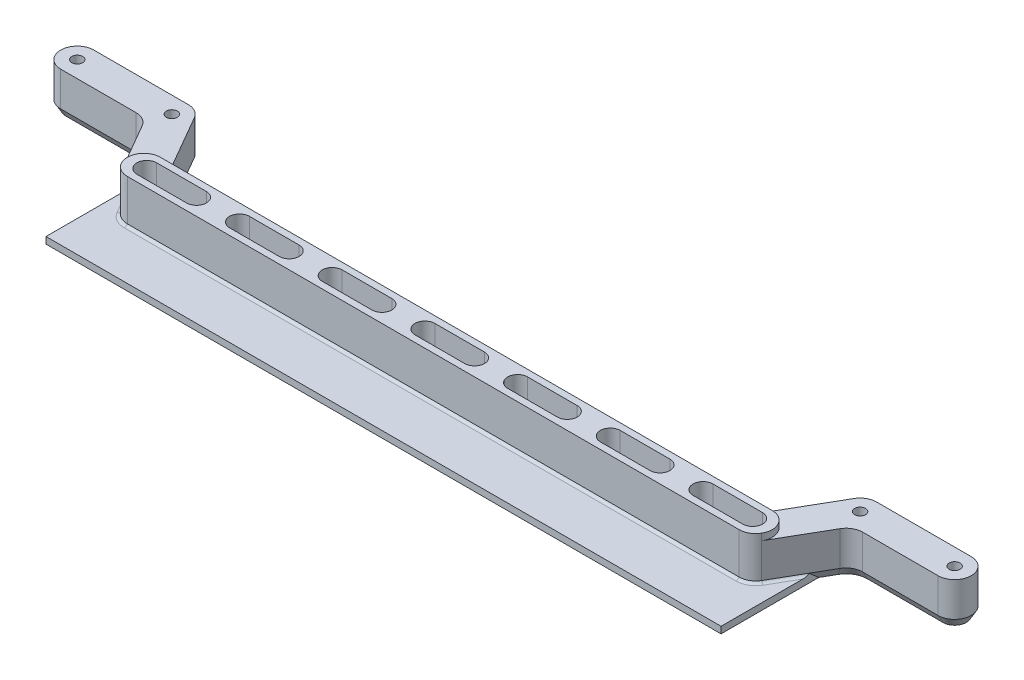
from build123d import *

# Parameters (mm, degrees)
SKETCH_1_R                 = 1.65
EXTRUDE_1_DEPTH            = 15
FILLET_1_R                 = 5
CHAMFER_1_SIZE             = 1.5
CHAMFER_1_SIZE2            = 2.598076211
SKETCH_3_R                 = 2.5
CUT_EXTRUDE_1_DEPTH        = 3
SKETCH_4_W                 = 353.760068279
SKETCH_4_H                 = 71.916373997
CUT_EXTRUDE_2_DEPTH        = 2
FILLET_2_R                 = 5
CUT_EXTRUDE_3_DEPTH        = 12
PATTERN_LINEAR_1_COUNT     = 4
PATTERN_LINEAR_1_PITCH     = 28
PATTERN_LINEAR_1_COL_COUNT = 4
PATTERN_LINEAR_1_COL_PITCH = 28
EXTRUDE_2_DEPTH            = 2
FILLET_3_R                 = 1


# Some blends are built 0.0001 mm under size
with BuildPart() as part:
    # 草图1 → 凸台-拉伸1 (new body)
    with BuildSketch(Plane(origin=(0, 0, 0), x_dir=(1, 0, 0), z_dir=(0, 1, 0))):
        with BuildLine():
            Line((14.275, 5), (-14.275, 5))
            ThreePointArc((-14.275, 5), (-19.275, 0), (-14.275, -5))
            Line((-14.275, -5), (11.388248654, -5))
            Line((11.388248654, -5), (21.491878365, -22.5))
            ThreePointArc((21.491878365, -22.5), (23.322005384, -24.330127019), (25.822005384, -25))
            Line((25.822005384, -25), (210.627994616, -25))
            ThreePointArc((210.627994616, -25), (213.127994616, -24.330127019), (214.958121635, -22.5))
            Line((214.958121635, -22.5), (225.061751346, -5))
            Line((225.061751346, -5), (250.725, -5))
            ThreePointArc((250.725, -5), (255.725, 0), (250.725, 5))
            Line((250.725, 5), (222.175, 5))
            ThreePointArc((222.175, 5), (219.675, 4.330127019), (217.844872981, 2.5))
            Line((217.844872981, 2.5), (207.74124327, -15))
            Line((207.74124327, -15), (28.70875673, -15))
            Line((28.70875673, -15), (18.605127019, 2.5))
            ThreePointArc((18.605127019, 2.5), (16.775, 4.330127019), (14.275, 5))
        make_face()
        with Locations(Location((-14.275, 0, 0), (0, 0, 270))):
            Circle(SKETCH_1_R, mode=Mode.SUBTRACT)
        with Locations(Location((14.275, 0, 0), (0, 0, 270))):
            Circle(SKETCH_1_R, mode=Mode.SUBTRACT)
        with Locations(Location((222.175, 0, 0), (0, 0, 270))):
            Circle(SKETCH_1_R, mode=Mode.SUBTRACT)
        with Locations(Location((250.725, 0, 0), (0, 0, 270))):
            Circle(SKETCH_1_R, mode=Mode.SUBTRACT)
    extrude(amount=EXTRUDE_1_DEPTH)

    # 圆角1
    fillet_1_edges = [part.edges().sort_by_distance(p)[0] for p in [
        (225.061751346, 7.5, 5),
        (11.388248654, 7.5, 5),
        (28.70875673, 7.5, 15),
        (207.74124327, 7.5, 15),
    ]]
    fillet(fillet_1_edges, radius=FILLET_1_R)

    # 倒角1
    chamfer_1_edges = [part.edges().sort_by_distance(p)[0] for p in [
        (255.725, 0, 0),
        (219.288248654, 0, 15),
        (213.127994616, 0, 24.330127019),
        (118.225, 0, 25),
        (23.322005384, 0, 24.330127019),
        (-2.886751346, 0, 5),
        (-19.275, 0, 0),
        (0, 0, -5),
        (16.775, 0, -4.330127019),
        (22.935254038, 0, 5),
        (219.675, 0, -4.330127019),
        (236.45, 0, -5),
        (118.225, 0, 15),
        (213.514745962, 0, 5),
        (239.336751346, 0, 5),
        (17.161751346, 0, 15),
        (207.354491924, 0, 14.330127019),
        (29.095508076, 0, 14.330127019),
        (225.448502692, 0, 5.669872981),
        (11.001497308, 0, 5.669872981),
    ]]
    chamfer_1_side = [part.faces().sort_by_distance(p)[0] for p in [
        (216.892549382, 0, 13.616842381),
    ]]
    chamfer(chamfer_1_edges, length=CHAMFER_1_SIZE, length2=CHAMFER_1_SIZE2, reference=chamfer_1_side[0])

    # 草图3 → 切除-拉伸1 (cut)
    with BuildSketch(Plane(origin=(0, 0, 0), x_dir=(1, 0, 0), z_dir=(0, 1, 0))):
        with Locations(Location((-14.275, 0, 0), (0, 0, 270))):
            Circle(SKETCH_3_R)
        with Locations(Location((14.275, 0, 0), (0, 0, 270))):
            Circle(SKETCH_3_R)
        with Locations(Location((250.725, 0, 0), (0, 0, 270))):
            Circle(SKETCH_3_R)
        with Locations(Location((222.175, 0, 0), (0, 0, 270))):
            Circle(SKETCH_3_R)
    extrude(amount=CUT_EXTRUDE_1_DEPTH, mode=Mode.SUBTRACT)

    # 草图4 → 切除-拉伸2 (cut)
    with BuildSketch(Plane(origin=(0, 15, 0), x_dir=(1, 0, 0), z_dir=(0, 1, 0))):
        with Locations((127.300161481, 20.958186999)):
            Rectangle(SKETCH_4_W, SKETCH_4_H)
    extrude(amount=-CUT_EXTRUDE_2_DEPTH, mode=Mode.SUBTRACT)

    # 圆角2
    fillet_2_edges = [part.edges().sort_by_distance(p)[0] for p in [
        (17.161751346, 14, 15),
        (219.288248654, 14, 15),
    ]]
    fillet(fillet_2_edges, radius=FILLET_2_R - 0.0001)  # a hair under: the kernel refuses the full size

    # 草图5 → 切除-拉伸3 (cut)
    with BuildSketch(Plane(origin=(0, 15, 0), x_dir=(1, 0, 0), z_dir=(0, 1, 0))):
        with BuildLine():
            Line((110.725, -17), (125.725, -17))
            ThreePointArc((125.725, -17), (128.725, -20), (125.725, -23))
            Line((125.725, -23), (110.725, -23))
            ThreePointArc((110.725, -23), (107.725, -20), (110.725, -17))
        make_face()
    cut_extrude_3 = extrude(amount=-CUT_EXTRUDE_3_DEPTH, mode=Mode.SUBTRACT)

    # 阵列(线性)1: 切除-拉伸3 ×4
    with Locations(*[(i * PATTERN_LINEAR_1_PITCH, 0, 0) for i in range(1, PATTERN_LINEAR_1_COUNT)]):
        add(cut_extrude_3, mode=Mode.SUBTRACT)

    # 阵列(线性)1 col: 切除-拉伸3 ×4
    with Locations(*[(-i * PATTERN_LINEAR_1_COL_PITCH, 0, 0) for i in range(1, PATTERN_LINEAR_1_COL_COUNT)]):
        add(cut_extrude_3, mode=Mode.SUBTRACT)

    # 草图6 → 凸台-拉伸2 (add)
    with BuildSketch(Plane.XZ):
        Polygon((25.533330249, 23.5), (210.339319482, 23.5), (220.175, 6.464101615), (220.175, 23.5), (220.175, 40), (16.275, 40), (16.275, 23), (16.275, 7.464101615), align=None)
    extrude(amount=-EXTRUDE_2_DEPTH)

    # 圆角3
    # the kernel refuses this fillet: 1 mm, written as the material it adds along each edge
    with BuildSketch(Plane(origin=(214.659083529, 2, 22.327350269), x_dir=(0.4330127018948014, 0.8660254037827173, 0.2500000000014904), z_dir=(0.4999999999999995, 0, -0.866025403784439))) as fillet_3_piece_1_section:
        with BuildLine():
            CenterArc((1.496511696, 0.592034292), FILLET_3_R, 150, 66.301500994)
            Line((0.630486292, 1.092034292), (0.613165784, 1.102034292))
            Line((0.613165784, 1.102034292), (-0.017320508, 0.01))
            Line((-0.017320508, 0.01), (0, -0.02))
            ThreePointArc((0, -0.02), (0.345299462, -0.02), (0.674480668, -0.011840686))
            Line((0.674480668, -0.011840686), (0.690598923, 0))
        make_face()
    fillet_3_piece_1 = extrude(amount=14.184264403, mode=Mode.PRIVATE)
    fillet_3_piece_1 = split(fillet_3_piece_1, bisect_by=Plane(origin=(220.175, 2.148183279, 18.272519996), z_dir=(-1, 0, 0)), keep=Keep.TOP, mode=Mode.PRIVATE)
    add(fillet_3_piece_1)
    with BuildSketch(Plane(origin=(210.627994616, 2, 20), x_dir=(0, 0, 1), z_dir=(-1, 0, 0))) as fillet_3_piece_2:
        with BuildLine():
            CenterArc((5.915673123, 1), FILLET_3_R, 203.698499006, 66.301500994)
            Line((5.915673123, 0), (5.915673123, -0.02))
            Line((5.915673123, -0.02), (4.654700538, -0.02))
            Line((4.654700538, -0.02), (4.63738003, 0.01))
            ThreePointArc((4.63738003, 0.01), (4.810029761, 0.309038106), (4.981686538, 0.590037736))
            Line((4.981686538, 0.590037736), (5, 0.598076211))
        make_face()
    revolve(axis=Axis((210.627994616, 2, 20), (0, 1, 0)), revolution_arc=60)
    with BuildSketch(Plane(origin=(25.822005384, 2, 24.654700538), x_dir=(0, 0, 1), z_dir=(1, 0, 0))) as fillet_3_piece_3:
        with BuildLine():
            CenterArc((1.260972585, -1), FILLET_3_R, 90, 66.301500994)
            Line((0.345299462, -0.598076211), (0.326985999, -0.590037736))
            ThreePointArc((0.326985999, -0.590037736), (0.155329223, -0.309038106), (-0.017320508, -0.01))
            Line((-0.017320508, -0.01), (0, 0.02))
            Line((0, 0.02), (1.260972585, 0.02))
            Line((1.260972585, 0.02), (1.260972585, 0))
        make_face()
    extrude(amount=184.805989232)
    with BuildSketch(Plane(origin=(25.822005384, 2, 20), x_dir=(-0.8660254037844389, 0, 0.49999999999999944), z_dir=(-0.49999999999999944, 0, -0.8660254037844389))) as fillet_3_piece_4:
        with BuildLine():
            CenterArc((5.915673123, 1), FILLET_3_R, 203.698499006, 66.301500994)
            Line((5, 0.598076211), (4.981686538, 0.590037736))
            ThreePointArc((4.981686538, 0.590037736), (4.810029761, 0.309038106), (4.63738003, 0.01))
            Line((4.63738003, 0.01), (4.654700538, -0.02))
            Line((4.654700538, -0.02), (5.915673123, -0.02))
            Line((5.915673123, -0.02), (5.915673123, 0))
        make_face()
    revolve(axis=Axis((25.822005384, 2, 20), (0, 1, 0)), revolution_arc=60)
    with BuildSketch(Plane(origin=(14.698784269, 2, 10.043416963), x_dir=(-0.86602540378444, 0, 0.4999999999999978), z_dir=(0.4999999999999977, 0, 0.86602540378444))) as fillet_3_piece_5_section:
        with BuildLine():
            CenterArc((1.260972585, -1), FILLET_3_R, 90, 66.301500994)
            Line((0.345299462, -0.598076211), (0.326985999, -0.590037736))
            ThreePointArc((0.326985999, -0.590037736), (0.155329223, -0.309038106), (-0.017320508, -0.01))
            Line((-0.017320508, -0.01), (0, 0.02))
            Line((0, 0.02), (1.260972585, 0.02))
            Line((1.260972585, 0.02), (1.260972585, 0))
        make_face()
    fillet_3_piece_5 = extrude(amount=14.184264403, mode=Mode.PRIVATE)
    fillet_3_piece_5 = split(fillet_3_piece_5, bisect_by=Plane(origin=(16.275, 2.148183279, 18.272519996), z_dir=(1, 0, 0)), keep=Keep.TOP, mode=Mode.PRIVATE)
    add(fillet_3_piece_5)


solid = part.part
